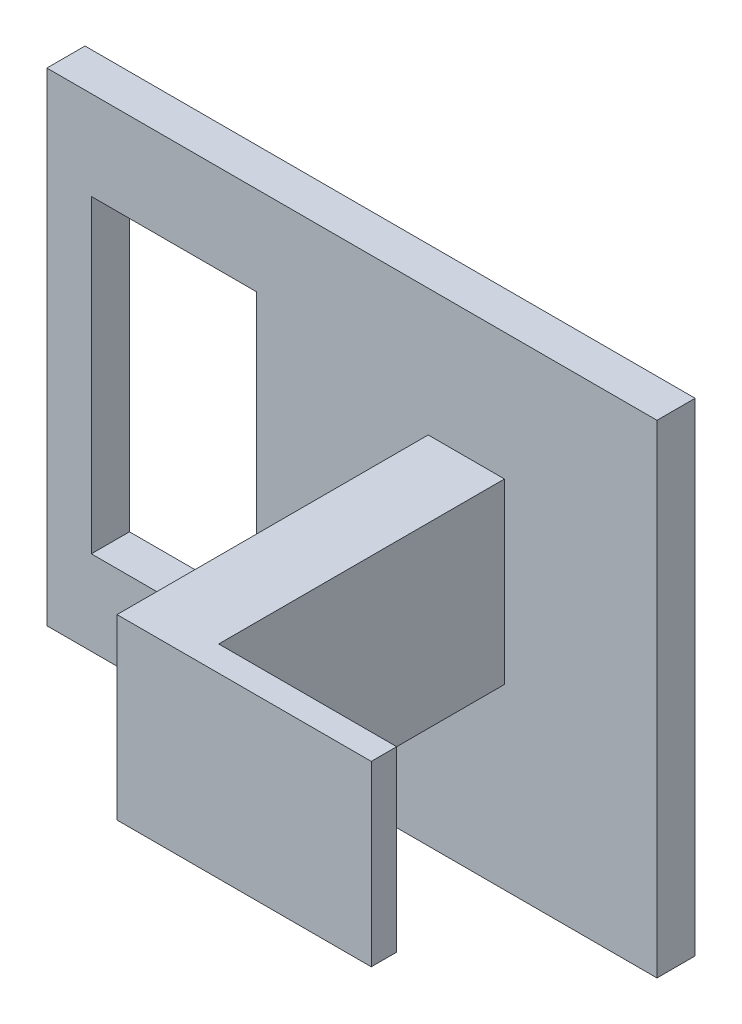
from build123d import *

# Parameters (mm, degrees)
SERVO_SHELF_START           = -27.480025
SKETCH1_W                   = 48
SKETCH1_H                   = 38
SKETCH1_W_2                 = 13
SKETCH1_H_2                 = 24.35
SERVO_SHELF_DEPTH           = 3
OUTBOARD_RISER_START        = -25.480025
SKETCH2_W                   = 6
SKETCH2_H                   = 14
OUTBOARD_RISER_DEPTH        = 24.480025
PLATE_ATTACHMENT_FOOT_START = -2
SKETCH3_W                   = 20
SKETCH3_H                   = 14
PLATE_ATTACHMENT_FOOT_DEPTH = 2


with BuildPart() as part:
    # Sketch1 → Servo_Shelf (new body)
    with BuildSketch(Plane.XY.offset(SERVO_SHELF_START)):
        with Locations((-46, 19)):
            Rectangle(SKETCH1_W, SKETCH1_H)
        with Locations((-60, 18.825)):
            Rectangle(SKETCH1_W_2, SKETCH1_H_2, mode=Mode.SUBTRACT)
    extrude(amount=SERVO_SHELF_DEPTH)

    # Sketch2 → Outboard_Riser (add)
    with BuildSketch(Plane.XY.offset(OUTBOARD_RISER_START)):
        with Locations((-37, 21)):
            Rectangle(SKETCH2_W, SKETCH2_H)
    extrude(amount=OUTBOARD_RISER_DEPTH)

    # Sketch3 → Plate_Attachment_Foot (add)
    with BuildSketch(Plane.XY.offset(PLATE_ATTACHMENT_FOOT_START)):
        with Locations((-30, 21)):
            Rectangle(SKETCH3_W, SKETCH3_H)
    extrude(amount=PLATE_ATTACHMENT_FOOT_DEPTH)


solid = part.part
